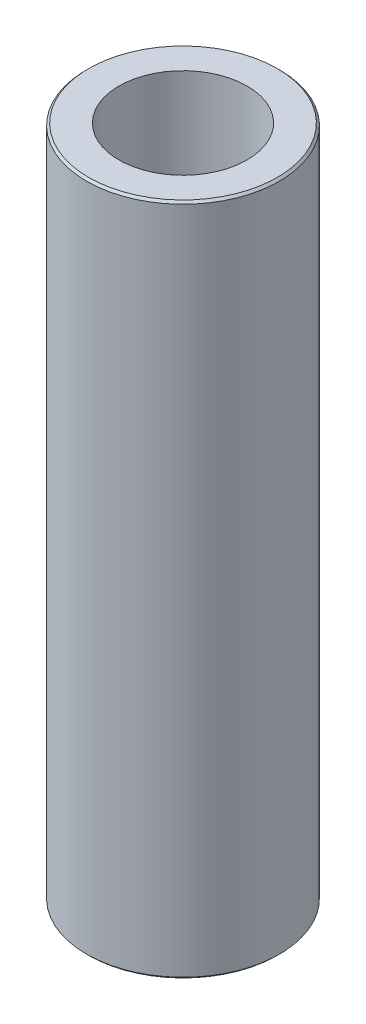
from build123d import *

# Parameters (mm, degrees)
SKETCH1_R           = 45
BOSS_EXTRUDE1_DEPTH = 314.226367639
SKETCH2_R           = 29.884970275
CUT_EXTRUDE1_DEPTH  = 321.606004497
CHAMFER1_SIZE       = 1.010928635


with BuildPart() as part:
    # Sketch1 → Boss-Extrude1 (new body)
    with BuildSketch(Plane(origin=(0, 0, 0), x_dir=(1, 0, 0), z_dir=(0, 1, 0))):
        Circle(SKETCH1_R)
    extrude(amount=BOSS_EXTRUDE1_DEPTH)

    # Sketch2 → Cut-Extrude1 (cut, through all)
    with BuildSketch(Plane(origin=(0, 0, 0), x_dir=(1, 0, 0), z_dir=(0, 1, 0))):
        Circle(SKETCH2_R)
    extrude(amount=CUT_EXTRUDE1_DEPTH, mode=Mode.SUBTRACT)

    # Chamfer1
    chamfer1_edges = [part.edges().sort_by_distance(p)[0] for p in [
        (-45, 314.226367639, 0),
        (-45, 0, 0),
    ]]
    chamfer(chamfer1_edges, length=CHAMFER1_SIZE)


solid = part.part
